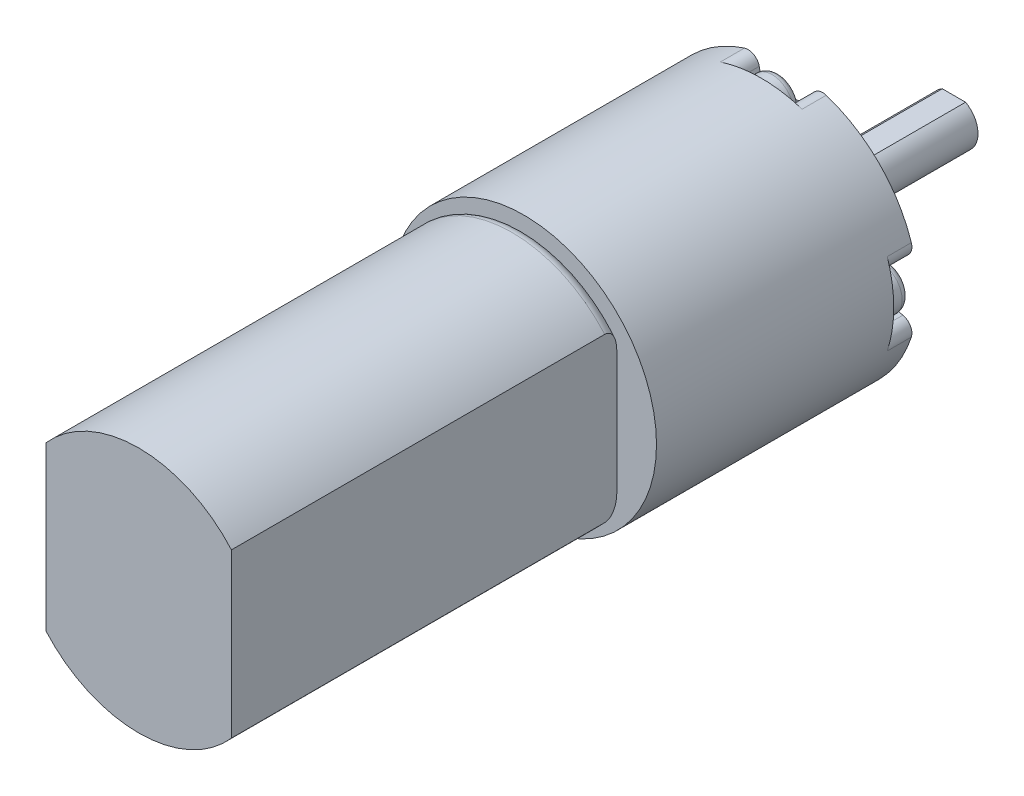
from build123d import *

# Parameters (mm, degrees)
ENL_V_MAT_EXTRU_1_REACH            = 71.464
ENL_V_START                        = -2
ENL_V_MAT_EXTRU_2_DEPTH            = 2
ENL_V_START_2                      = -12
ENL_V_MAT_EXTRU_3_DEPTH            = 12
ENL_V_MAT_EXTRU_4_DEPTH            = 2
ESQUISSE12_R                       = 1.8
BOSS_EXTRU_2_DEPTH                 = 1.5
CONG_1_R                           = 0.6
ENL_V_MAT_EXTRU_6_DEPTH            = 0.5
R_P_TITION_CIRCULAIRE1_COUNT       = 4
CONG_1_OF_R_P_TITION_CIRCULAIRE1_R = 0.6
ESQUISSE18_R                       = 1
ENL_V_MAT_EXTRU_7_DEPTH            = 5
R_P_TITION_CIRCULAIRE2_COUNT       = 4


# Read off the part's stored shape, not the designer's step: Révolution2
with BuildPart() as part:
    # Révolution2 outline → Révolution2 (revolve)
    with BuildSketch(Plane.XZ):
        with BuildLine():
            ThreePointArc((9.253, -32), (9.960106781, -31.707106781), (10.253, -31))
            Line((10.253, -31), (10.253, 0))
            Line((10.253, 0), (0, 0))
            Line((0, 0), (0, -67.7))
            Line((0, -67.7), (2, -67.7))
            Line((2, -67.7), (2, -55.7))
            Line((2, -55.7), (7, -55.7))
            Line((7, -55.7), (7, -53.7))
            Line((7, -53.7), (11, -53.7))
            Line((11, -53.7), (11, -32))
            Line((11, -32), (9.253, -32))
        make_face()
    revolve(axis=Axis((0, 0, 0), (0, 0, 1)))

    # Enlèv. mat.-Extru.1: up to this face of the body (flat: up to its plane)
    enl_v_mat_extru_1_end = Plane(part.part.faces().sort_by_distance((-10.688873016, 0, -32))[0])
    # Esquisse4 → Enlèv. mat.-Extru.1 (cut, up to the picked face)
    with BuildSketch(Plane.XY, mode=Mode.PRIVATE) as enl_v_mat_extru_1_sk1:
        with BuildLine():
            Line((7.7, 6.770081905), (7.7, -6.770081905))
            ThreePointArc((7.7, -6.770081905), (10.253, 0), (7.7, 6.770081905))
        make_face()
    enl_v_mat_extru_1_tool1 = split(extrude(enl_v_mat_extru_1_sk1.sketch, amount=-ENL_V_MAT_EXTRU_1_REACH, mode=Mode.PRIVATE), bisect_by=enl_v_mat_extru_1_end, keep=Keep.BOTH, mode=Mode.PRIVATE)
    enl_v_mat_extru_1 = enl_v_mat_extru_1_tool1.solids().sort_by(Axis((8.732948, 0, 0), (0, 0, -1)))[0]
    add(enl_v_mat_extru_1, mode=Mode.SUBTRACT)

    # Esquisse5 → Enlèv. mat.-Extru.2 (cut)
    with BuildSketch(Plane(origin=(0, 0, -55.7), x_dir=(-1, 0, 0), z_dir=(0, 0, -1)).offset(ENL_V_START)):
        with BuildLine():
            Line((-6, -3.605551275), (-6, 3.605551275))
            ThreePointArc((-6, 3.605551275), (-7, 0), (-6, -3.605551275))
        make_face()
    enl_v_mat_extru_2 = extrude(amount=ENL_V_MAT_EXTRU_2_DEPTH, mode=Mode.SUBTRACT)

    # Symétrie1: Enlèv. mat.-Extru.1, Enlèv. mat.-Extru.2 across plane
    add(enl_v_mat_extru_1.mirror(Plane(origin=(0, 0, 0), x_dir=(0, 0, 1), z_dir=(1, 0, 0))), mode=Mode.SUBTRACT)
    add(enl_v_mat_extru_2.mirror(Plane(origin=(0, 0, 0), x_dir=(0, 0, 1), z_dir=(1, 0, 0))), mode=Mode.SUBTRACT)

    # Esquisse6 → Enlèv. mat.-Extru.3 (cut)
    with BuildSketch(Plane(origin=(0, 0, -67.7), x_dir=(-1, 0, 0), z_dir=(0, 0, -1)).offset(ENL_V_START_2)):
        with BuildLine():
            Line((-0.968245837, 1.75), (0.968245837, 1.75))
            ThreePointArc((0.968245837, 1.75), (0, 2), (-0.968245837, 1.75))
        make_face()
    extrude(amount=ENL_V_MAT_EXTRU_3_DEPTH, mode=Mode.SUBTRACT)

    # Esquisse7 → Enlèv. mat.-Extru.4 (cut)
    with BuildSketch(Plane(origin=(0, 0, -53.7), x_dir=(-1, 0, 0), z_dir=(0, 0, -1)).offset(ENL_V_START)):
        with BuildLine():
            Line((-2, 9), (-2.169304578, 9.761870602))
            ThreePointArc((-2.169304578, 9.761870602), (-2.627532331, 10.383578164), (-3.395796013, 10.46272285))
            ThreePointArc((-3.395796013, 10.46272285), (0, 11), (3.395796013, 10.46272285))
            ThreePointArc((3.395796013, 10.46272285), (2.627532331, 10.383578164), (2.169304578, 9.761870602))
            Line((2.169304578, 9.761870602), (2, 9))
            ThreePointArc((2, 9), (0, 7), (-2, 9))
        make_face()
    enl_v_mat_extru_4 = extrude(amount=ENL_V_MAT_EXTRU_4_DEPTH, mode=Mode.SUBTRACT)

    # Esquisse12 → Boss.-Extru.2 (add)
    with BuildSketch(Plane(origin=(0, 0, -51.7), x_dir=(-1, 0, 0), z_dir=(0, 0, -1))):
        with Locations((0, 9)):
            Circle(ESQUISSE12_R)
    boss_extru_2 = extrude(amount=BOSS_EXTRU_2_DEPTH)

    # Congé1
    cong_1_edges = [part.edges().sort_by_distance(p)[0] for p in [
        (1.8, 9, -53.2),
    ]]
    fillet(cong_1_edges, radius=CONG_1_R)

    # Esquisse13 → Enlèv. mat.-Extru.6 (cut)
    with BuildSketch(Plane(origin=(0, 0, -53.2), x_dir=(-1, 0, 0), z_dir=(0, 0, -1))):
        Polygon((-0.2, 9.2), (-0.2, 10), (0.2, 10), (0.2, 9.2), (1, 9.2), (1, 8.8), (0.2, 8.8), (0.2, 8), (-0.2, 8), (-0.2, 8.8), (-1, 8.8), (-1, 9.2), align=None)
    enl_v_mat_extru_6 = extrude(amount=-ENL_V_MAT_EXTRU_6_DEPTH, mode=Mode.SUBTRACT)

    # Répétition circulaire1: Enlèv. mat.-Extru.4, Boss.-Extru.2, Enlèv. mat.-Extru.6 ×4 about axis
    r_p_tition_circulaire1_axis = Axis((0, 0, 0), (0, 0, 1))
    add([enl_v_mat_extru_4.rotate(r_p_tition_circulaire1_axis, i * 360 / R_P_TITION_CIRCULAIRE1_COUNT) for i in range(1, R_P_TITION_CIRCULAIRE1_COUNT)], mode=Mode.SUBTRACT)
    add([boss_extru_2.rotate(r_p_tition_circulaire1_axis, i * 360 / R_P_TITION_CIRCULAIRE1_COUNT) for i in range(1, R_P_TITION_CIRCULAIRE1_COUNT)])
    add([enl_v_mat_extru_6.rotate(r_p_tition_circulaire1_axis, i * 360 / R_P_TITION_CIRCULAIRE1_COUNT) for i in range(1, R_P_TITION_CIRCULAIRE1_COUNT)], mode=Mode.SUBTRACT)

    # Congé1 of Répétition circulaire1
    cong_1_of_r_p_tition_circulaire1_edges = [part.edges().sort_by_distance(p)[0] for p in [
        (-9, 1.8, -53.2),
        (-1.8, -9, -53.2),
        (9, -1.8, -53.2),
    ]]
    fillet(cong_1_of_r_p_tition_circulaire1_edges, radius=CONG_1_OF_R_P_TITION_CIRCULAIRE1_R)

    # Esquisse18 → Enlèv. mat.-Extru.7 (cut)
    with BuildSketch(Plane(origin=(0, 0, -53.7), x_dir=(-1, 0, 0), z_dir=(0, 0, -1))):
        with Locations((6.363961031, 6.363961031)):
            Circle(ESQUISSE18_R)
    enl_v_mat_extru_7 = extrude(amount=-ENL_V_MAT_EXTRU_7_DEPTH, mode=Mode.SUBTRACT)

    # Répétition circulaire2: Enlèv. mat.-Extru.7 ×4 about axis
    r_p_tition_circulaire2_axis = Axis((0, 0, 0), (0, 0, 1))
    for i in range(1, R_P_TITION_CIRCULAIRE2_COUNT):
        add(enl_v_mat_extru_7.rotate(r_p_tition_circulaire2_axis, i * 360 / R_P_TITION_CIRCULAIRE2_COUNT), mode=Mode.SUBTRACT)


solid = part.part
